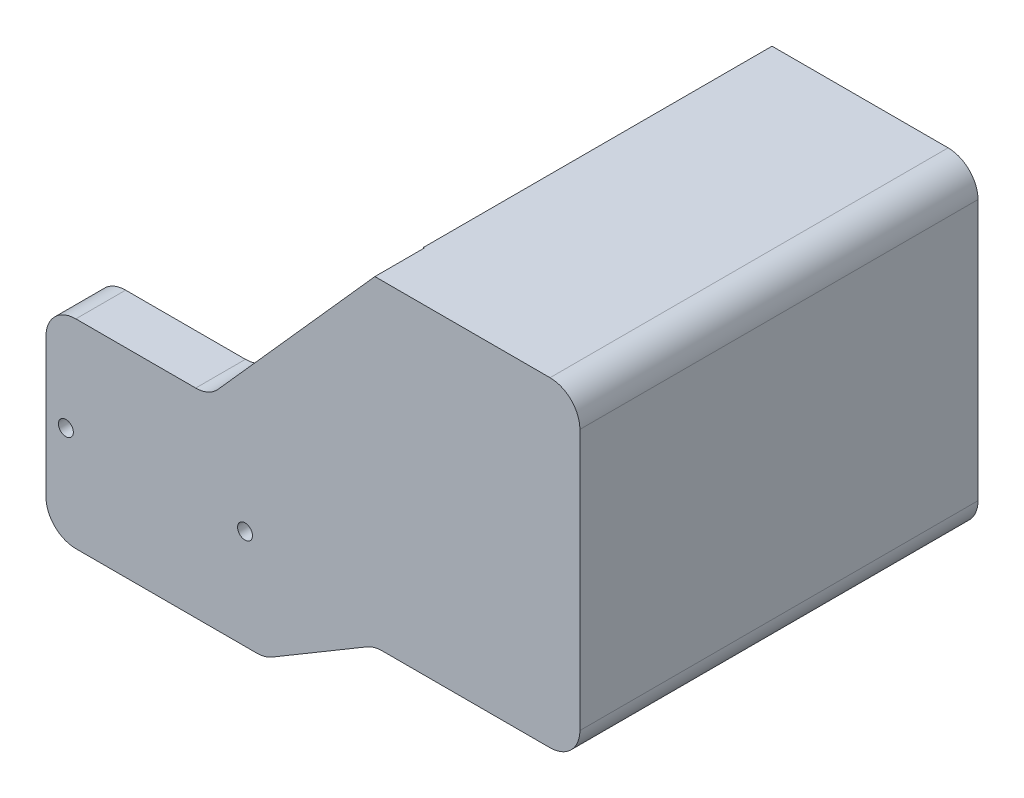
from build123d import *

# Parameters (mm, degrees)
CROQUIS1_W                 = 22
CROQUIS1_H                 = 20
SALIENTE_EXTRUIR1_DEPTH    = 30
SALIENTE_EXTRUIR1_2_DEPTH  = 30
CROQUIS3_W                 = 20.695436737
CROQUIS3_H                 = 32.204103304
SALIENTE_EXTRUIR2_DEPTH    = 5
CROQUIS4_W                 = 22
CROQUIS4_H                 = 20
CORTAR_EXTRUIR1_DEPTH      = 20
CROQUIS5_W                 = 22
CROQUIS5_H                 = 20
SALIENTE_EXTRUIR3_DEPTH    = 10
CROQUIS6_W                 = 22
CROQUIS6_H                 = 20
CORTAR_EXTRUIR2_DEPTH      = 10
CROQUIS7_W                 = 22
CROQUIS7_H                 = 20
CORTAR_EXTRUIR3_DEPTH      = 5
SALIENTE_EXTRUIR6_DEPTH    = 5
REDONDEO2_R                = 3
REDONDEO3_R                = 3
CROQUIS12_R                = 0.75
CORTAR_EXTRUIR4_DEPTH      = 7
REDONDEO4_R                = 3
REDONDEO5_R                = 3
REDONDEO6_R                = 3
REDONDEO7_R                = 3
REDONDEO8_R                = 3
CROQUIS13_R                = 0.75
SALIENTE_EXTRUIR7_DEPTH    = 5
CORTAR_EXTRUIR5_DEPTH      = 10
CORTAR_EXTRUIR5_DEPTH_BACK = 6
CROQUIS14_R                = 0.75
CROQUIS15_W                = 15.695436737
CROQUIS15_H                = 22.399714036
SALIENTE_EXTRUIR8_DEPTH    = 1.02
CROQUIS16_W                = 0.095436737
CROQUIS16_H                = 4.904389268
SALIENTE_EXTRUIR9_DEPTH    = 30.02


with BuildPart() as part:
    # Croquis1 → Saliente-Extruir1 (new body)
    with BuildSketch(Plane.XY):
        Rectangle(CROQUIS1_W, CROQUIS1_H)
    extrude(amount=-SALIENTE_EXTRUIR1_DEPTH)

    # Croquis4 → Cortar-Extruir1 (cut)
    with BuildSketch(Plane(origin=(0, 0, -30), x_dir=(-1, 0, 0), z_dir=(0, 0, -1))):
        Rectangle(CROQUIS4_W, CROQUIS4_H)
    extrude(amount=-CORTAR_EXTRUIR1_DEPTH, mode=Mode.SUBTRACT)

    # Croquis5 → Saliente-Extruir3 (add)
    with BuildSketch(Plane.XY):
        Rectangle(CROQUIS5_W, CROQUIS5_H)
    extrude(amount=SALIENTE_EXTRUIR3_DEPTH)

    # Croquis6 → Cortar-Extruir2 (cut)
    with BuildSketch(Plane(origin=(0, 0, -10), x_dir=(-1, 0, 0), z_dir=(0, 0, -1))):
        Rectangle(CROQUIS6_W, CROQUIS6_H)
    extrude(amount=-CORTAR_EXTRUIR2_DEPTH, mode=Mode.SUBTRACT)

    # Croquis7 → Cortar-Extruir3 (cut)
    with BuildSketch(Plane.XY.offset(10)):
        Rectangle(CROQUIS7_W, CROQUIS7_H)
    extrude(amount=-CORTAR_EXTRUIR3_DEPTH, mode=Mode.SUBTRACT)



with BuildPart() as body_2:
    # Croquis1 → Saliente-Extruir1 2 (new body)
    with BuildSketch(Plane.XY):
        Polygon((37.645436737, 1.4), (37.645436737, 23.799714036), (22.045436737, 23.799714036), (22.045436737, 28.704103304), (42.645436737, 28.704103304), (42.645436737, -3.5), (21.95, -3.5), (21.95, 1.4), align=None)
    extrude(amount=-SALIENTE_EXTRUIR1_2_DEPTH)

    # Croquis3 → Saliente-Extruir2 (add)
    with BuildSketch(Plane(origin=(0, 0, -30), x_dir=(-1, 0, 0), z_dir=(0, 0, -1))):
        with Locations((-32.297718368, 12.602051652)):
            Rectangle(CROQUIS3_W, CROQUIS3_H)
    extrude(amount=SALIENTE_EXTRUIR2_DEPTH)


with BuildPart() as part_1:
    add(part.part)

    add(body_2.part)  # Saliente-Extruir6 merges body 2
    # Croquis8 → Saliente-Extruir6 (add)
    with BuildSketch(Plane.XY.offset(5)):
        Polygon((11, -10), (11, -5.1), (11, 10), (5.385440375, 10), (22.045436737, 28.704103304), (42.645436737, 28.704103304), (42.645436737, -3.5), (21.95, -3.5), align=None)
    extrude(amount=-SALIENTE_EXTRUIR6_DEPTH)

    # Redondeo2
    redondeo2_edges = [part_1.edges().sort_by_distance(p)[0] for p in [
        (-11, 10, 2.5),
    ]]
    fillet(redondeo2_edges, radius=REDONDEO2_R)

    # Redondeo3
    redondeo3_edges = [part_1.edges().sort_by_distance(p)[0] for p in [
        (-11, -10, 2.5),
    ]]
    fillet(redondeo3_edges, radius=REDONDEO3_R)

    # Croquis12 → Cortar-Extruir4 (cut)
    with BuildSketch(Plane.XY.offset(5)):
        with Locations((1.5, -8)):
            Circle(CROQUIS12_R)
        with Locations((1.5, 7.997026153)):
            Circle(CROQUIS12_R)
    extrude(amount=-CORTAR_EXTRUIR4_DEPTH, mode=Mode.SUBTRACT)

    # Redondeo4
    redondeo4_edges = [part_1.edges().sort_by_distance(p)[0] for p in [
        (11, -10, 2.5),
    ]]
    fillet(redondeo4_edges, radius=REDONDEO4_R)

    # Redondeo5
    redondeo5_edges = [part_1.edges().sort_by_distance(p)[0] for p in [
        (42.645436737, -3.5, -15),
    ]]
    fillet(redondeo5_edges, radius=REDONDEO5_R)

    # Redondeo6
    redondeo6_edges = [part_1.edges().sort_by_distance(p)[0] for p in [
        (42.645436737, 28.704103304, -15),
    ]]
    fillet(redondeo6_edges, radius=REDONDEO6_R)

    # Redondeo7
    redondeo7_edges = [part_1.edges().sort_by_distance(p)[0] for p in [
        (21.95, -3.5, 2.5),
    ]]
    fillet(redondeo7_edges, radius=REDONDEO7_R)

    # Redondeo8
    redondeo8_edges = [part_1.edges().sort_by_distance(p)[0] for p in [
        (5.385440375, 10, 2.5),
    ]]
    fillet(redondeo8_edges, radius=REDONDEO8_R)

    # Croquis13 → Saliente-Extruir7 (add)
    with BuildSketch(Plane.XY.offset(5)):
        with Locations((1.5, 7.997026153)):
            Circle(CROQUIS13_R)
        with Locations((1.5, -8)):
            Circle(CROQUIS13_R)
    extrude(amount=-SALIENTE_EXTRUIR7_DEPTH)

    # Croquis14 → Cortar-Extruir5 (cut, two sides: drawn at the far end of the back side and taken through both)
    with BuildSketch(Plane.XY.offset(5).offset(-CORTAR_EXTRUIR5_DEPTH_BACK)):
        with Locations((-9.002854226, 0)):
            Circle(CROQUIS14_R)
        with Locations((8.997145774, 0)):
            Circle(CROQUIS14_R)
    extrude(amount=CORTAR_EXTRUIR5_DEPTH + CORTAR_EXTRUIR5_DEPTH_BACK, mode=Mode.SUBTRACT)

    # Croquis15 → Saliente-Extruir8 (add)
    with BuildSketch(Plane.XY.offset(-30)):
        with Locations((29.797718369, 12.599857018)):
            Rectangle(CROQUIS15_W, CROQUIS15_H)
    extrude(amount=SALIENTE_EXTRUIR8_DEPTH)

    # Croquis16 → Saliente-Extruir9 (add)
    with BuildSketch(Plane.XY.offset(-30)):
        with Locations((21.997718369, 26.25190867)):
            Rectangle(CROQUIS16_W, CROQUIS16_H)
    extrude(amount=SALIENTE_EXTRUIR9_DEPTH)


solid = part_1.part
